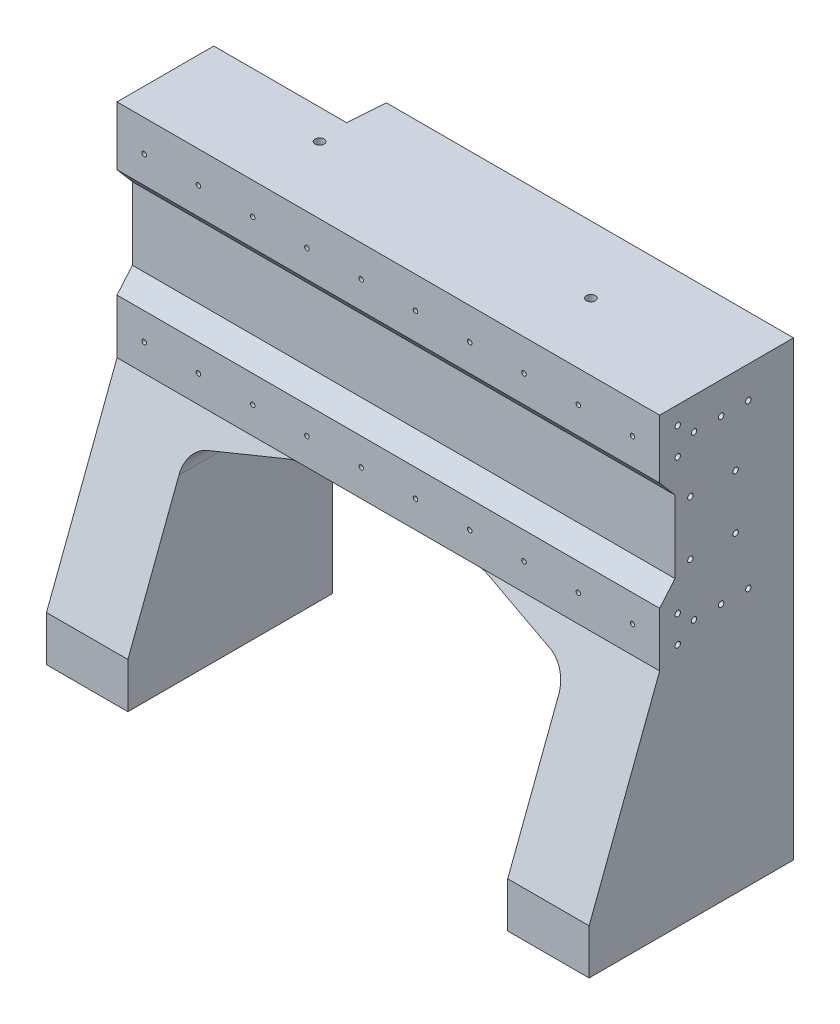
from build123d import *

# Parameters (mm, degrees)
SKETCH1_W                  = 600
SKETCH1_H                  = 500
BOSS_EXTRUDE1_DEPTH        = 226
SKETCH2_OUTSIDE_W          = 764.614
SKETCH2_OUTSIDE_H          = 664.614
CUT_EXTRUDE1_DEPTH         = 452.193971591
CUT_EXTRUDE8_DEPTH         = 452.193971591
CUT_EXTRUDE2_DEPTH         = 689.168583997
CUT_EXTRUDE3_DEPTH         = 689.168583997
SKETCH7_R                  = 2.5
CUT_EXTRUDE5_DEPTH         = 25
SKETCH8_R                  = 9.525
CUT_EXTRUDE6_DEPTH         = 35
F_6_0MM_DOWEL_HOLE1_D      = 6
F_6_0MM_DOWEL_HOLE1_DEPTH  = 28.197418143
F_6_0MM_DOWEL_HOLE1_TIP    = 1.802581857
F_6_0MM_DOWEL_HOLE2_D      = 6
F_6_0MM_DOWEL_HOLE2_DEPTH  = 28.197418143
F_6_0MM_DOWEL_HOLE2_TIP    = 1.802581857
F_6_0MM_DOWEL_HOLE3_D      = 6
F_6_0MM_DOWEL_HOLE3_DEPTH  = 28.197418143
F_6_0MM_DOWEL_HOLE3_TIP    = 1.802581857
FILLET2_R                  = 30
F_10_0MM_DOWEL_HOLE1_D     = 10
F_10_0MM_DOWEL_HOLE1_DEPTH = 28
F_10_0MM_DOWEL_HOLE1_TIP   = 3.004303095
CUT_EXTRUDE9_DEPTH         = 35
CHAMFER1_SIZE              = 6
CHAMFER1_SIZE_2            = 114.486820126
CHAMFER2_SIZE              = 3
CHAMFER2_SIZE_2            = 171.477335318
CHAMFER2_SIZE_3            = 42.90199877
CHAMFER3_SIZE              = 3
CHAMFER3_SIZE_2            = 171.477335318
CHAMFER3_SIZE_3            = 42.90199877
FILLET3_R                  = 8


with BuildPart() as part:
    # Sketch1 → Boss-Extrude1 (new body)
    with BuildSketch(Plane.XY):
        Rectangle(SKETCH1_W, SKETCH1_H)
    extrude(amount=BOSS_EXTRUDE1_DEPTH)

    # Sketch2 outside → Cut-Extrude1 (cut, through all)
    with BuildSketch(Plane.XY.offset(226)):
        Rectangle(SKETCH2_OUTSIDE_W, SKETCH2_OUTSIDE_H)
        Polygon((-210, -250), (-210, -225), (-210, -30), (210, -30), (210, -225), (210, -250), (300, -250), (300, 250), (-300, 250), (-300, -250), align=None, mode=Mode.SUBTRACT)
    extrude(amount=-CUT_EXTRUDE1_DEPTH, mode=Mode.SUBTRACT)

    # Sketch22 → Cut-Extrude8 (cut, through all)
    with BuildSketch(Plane.XY.offset(226)):
        Polygon((-210, -30), (210, -30), (105, 5), (0, 5), (-105, 5), align=None)
    extrude(amount=-CUT_EXTRUDE8_DEPTH, mode=Mode.SUBTRACT)

    # Sketch4 → Cut-Extrude2 (cut, through all)
    with BuildSketch(Plane.ZY.offset(300)):
        Polygon((148, 25), (148, 5), (226, -200), (226, -165), (226, -145), (226, 250), (148, 250), align=None)
    extrude(amount=-CUT_EXTRUDE2_DEPTH, mode=Mode.SUBTRACT)

    # Sketch5 → Cut-Extrude3 (cut, through all)
    with BuildSketch(Plane.ZY.offset(300)):
        Polygon((131, 160), (131, 165), (148, 185), (148, 65), (131, 85), (131, 90), (131, 125), align=None)
    extrude(amount=-CUT_EXTRUDE3_DEPTH, mode=Mode.SUBTRACT)

    # Sketch7 → Cut-Extrude5 (cut)
    with BuildSketch(Plane.XY.offset(148)):
        with Locations((-270, 215)):
            Circle(SKETCH7_R)
        with Locations((-210, 215)):
            Circle(SKETCH7_R)
        with Locations((-150, 215)):
            Circle(SKETCH7_R)
        with Locations((-90, 215)):
            Circle(SKETCH7_R)
        with Locations((-30, 215)):
            Circle(SKETCH7_R)
        with Locations((30, 215)):
            Circle(SKETCH7_R)
        with Locations((90, 215)):
            Circle(SKETCH7_R)
        with Locations((150, 215)):
            Circle(SKETCH7_R)
        with Locations((210, 215)):
            Circle(SKETCH7_R)
        with Locations((270, 215)):
            Circle(SKETCH7_R)
        with Locations((-210, 35)):
            Circle(SKETCH7_R)
        with Locations((-150, 35)):
            Circle(SKETCH7_R)
        with Locations((-90, 35)):
            Circle(SKETCH7_R)
        with Locations((-30, 35)):
            Circle(SKETCH7_R)
        with Locations((30, 35)):
            Circle(SKETCH7_R)
        with Locations((90, 35)):
            Circle(SKETCH7_R)
        with Locations((150, 35)):
            Circle(SKETCH7_R)
        with Locations((210, 35)):
            Circle(SKETCH7_R)
        with Locations((270, 35)):
            Circle(SKETCH7_R)
        with Locations((-270, 35)):
            Circle(SKETCH7_R)
    extrude(amount=-CUT_EXTRUDE5_DEPTH, mode=Mode.SUBTRACT)

    # Sketch8 → Cut-Extrude6 (cut)
    with BuildSketch(Plane.XZ.offset(250)):
        with Locations((240, 171)):
            Circle(SKETCH8_R)
        with Locations((275, 171)):
            Circle(SKETCH8_R)
        with Locations((240, 51)):
            Circle(SKETCH8_R)
        with Locations((275, 51)):
            Circle(SKETCH8_R)
        with Locations((-275, 51)):
            Circle(SKETCH8_R)
        with Locations((-240, 51)):
            Circle(SKETCH8_R)
        with Locations((-275, 171)):
            Circle(SKETCH8_R)
        with Locations((-240, 171)):
            Circle(SKETCH8_R)
    extrude(amount=-CUT_EXTRUDE6_DEPTH, mode=Mode.SUBTRACT)

    # Ø6.0mm Dowel Hole1
    with Locations(Plane.ZY.offset(300)):
        with Locations((114, 95), (64, 95), (64, 155), (114, 155), (98, 230), (98, 200), (98, 50), (98, 20), (68, 230), (68, 200), (68, 50), (68, 20)):
            Hole(F_6_0MM_DOWEL_HOLE1_D / 2, depth=F_6_0MM_DOWEL_HOLE1_DEPTH)
            with Locations((0, 0, -(F_6_0MM_DOWEL_HOLE1_DEPTH + F_6_0MM_DOWEL_HOLE1_TIP / 2))):  # 118° drill point
                Cone(0, F_6_0MM_DOWEL_HOLE1_D / 2, F_6_0MM_DOWEL_HOLE1_TIP, mode=Mode.SUBTRACT)

    # Ø6.0mm Dowel Hole2
    with Locations(Plane(origin=(300, 0, 0), x_dir=(0, 0, -1), z_dir=(1, 0, 0))):
        with Locations((-128, 230), (-128, 200), (-114, 155), (-64, 155), (-64, 95), (-114, 95), (-128, 50), (-128, 20)):
            Hole(F_6_0MM_DOWEL_HOLE2_D / 2, depth=F_6_0MM_DOWEL_HOLE2_DEPTH)
            with Locations((0, 0, -(F_6_0MM_DOWEL_HOLE2_DEPTH + F_6_0MM_DOWEL_HOLE2_TIP / 2))):  # 118° drill point
                Cone(0, F_6_0MM_DOWEL_HOLE2_D / 2, F_6_0MM_DOWEL_HOLE2_TIP, mode=Mode.SUBTRACT)

    # Ø6.0mm Dowel Hole3
    with Locations(Plane(origin=(300, 0, 0), x_dir=(0, 0, -1), z_dir=(1, 0, 0))):
        with Locations((-110, 215), (-80, 215), (-50, 215), (-50, 35), (-80, 35), (-110, 35)):
            Hole(F_6_0MM_DOWEL_HOLE3_D / 2, depth=F_6_0MM_DOWEL_HOLE3_DEPTH)
            with Locations((0, 0, -(F_6_0MM_DOWEL_HOLE3_DEPTH + F_6_0MM_DOWEL_HOLE3_TIP / 2))):  # 118° drill point
                Cone(0, F_6_0MM_DOWEL_HOLE3_D / 2, F_6_0MM_DOWEL_HOLE3_TIP, mode=Mode.SUBTRACT)

    # Fillet2
    fillet2_edges = [part.edges().sort_by_distance(p)[0] for p in [
        (210, -30, 80.658536585),
        (-210, -30, 80.658536585),
        (-105, 5, 74),
        (105, 5, 74),
    ]]
    fillet(fillet2_edges, radius=FILLET2_R)

    # Ø10.0mm Dowel Hole1
    with Locations(Plane(origin=(0, 250, 0), x_dir=(1, 0, 0), z_dir=(0, 1, 0))):
        with Locations((-150, -74), (150, -74)):
            Hole(F_10_0MM_DOWEL_HOLE1_D / 2, depth=F_10_0MM_DOWEL_HOLE1_DEPTH)
            with Locations((0, 0, -(F_10_0MM_DOWEL_HOLE1_DEPTH + F_10_0MM_DOWEL_HOLE1_TIP / 2))):  # 118° drill point
                Cone(0, F_10_0MM_DOWEL_HOLE1_D / 2, F_10_0MM_DOWEL_HOLE1_TIP, mode=Mode.SUBTRACT)

    # Sketch10 → Cut-Extrude9 (cut)
    with BuildSketch(Plane(origin=(0, 0, 0), x_dir=(-1, 0, 0), z_dir=(0, 0, -1))):
        Polygon((150, 142), (150, 138), (235, 138), (235, 142), (235, 155), (300, 155), (300, 250), (150, 250), (150, 155), align=None)
    extrude(amount=-CUT_EXTRUDE9_DEPTH, mode=Mode.SUBTRACT)

    # Chamfer1
    # the kernel refuses this chamfer: 114.486820126, 6 mm, written as the material it takes off along each edge
    with BuildSketch(Plane(origin=(-597.650645388, 250, 35), x_dir=(0, 0.5911482838883376, 0.8065628967761121), z_dir=(1, 0, 0))) as chamfer1_piece_1_section:
        Polygon((CHAMFER1_SIZE * 0.806562896776, CHAMFER1_SIZE * 0.591148283888), (-CHAMFER1_SIZE_2 * 0.59114828389, CHAMFER1_SIZE_2 * 0.806562896779), (0, 0), align=None)
    chamfer1_piece_1 = extrude(amount=447.650645388, mode=Mode.PRIVATE)
    chamfer1_piece_1 = split(chamfer1_piece_1, bisect_by=Plane(origin=(-267.5, 155, 37.049515036), z_dir=(0, 1, 0)), keep=Keep.TOP, mode=Mode.PRIVATE)
    add(chamfer1_piece_1, mode=Mode.SUBTRACT)
    with BuildSketch(Plane(origin=(-597.650645388, 250, 35), x_dir=(0, 0.5911482838883376, 0.8065628967761121), z_dir=(1, 0, 0))) as chamfer1_piece_2_section:
        Polygon((CHAMFER1_SIZE * 0.806562896776, CHAMFER1_SIZE * 0.591148283888), (-CHAMFER1_SIZE_2 * 0.59114828389, CHAMFER1_SIZE_2 * 0.806562896779), (0, 0), align=None)
    chamfer1_piece_2 = extrude(amount=447.650645388, mode=Mode.PRIVATE)
    chamfer1_piece_2 = split(chamfer1_piece_2, bisect_by=Plane(origin=(-192.5, 138, 35.345336882), z_dir=(0, 1, 0)), keep=Keep.TOP, mode=Mode.PRIVATE)
    chamfer1_piece_2 = split(chamfer1_piece_2, bisect_by=Plane(origin=(-235, 148.692020353, 35.345336882), z_dir=(1, 0, 0)), keep=Keep.TOP, mode=Mode.PRIVATE)
    add(chamfer1_piece_2, mode=Mode.SUBTRACT)

    # Chamfer2
    # the kernel refuses this chamfer: 171.477335318, 42.90199877, 3 mm, written as the material it adds along each edge
    with BuildSketch(Plane(origin=(-300, 155, 36.021260968), x_dir=(0, 0.4058983906880882, 0.9139182110215444), z_dir=(1, 0, 0))) as chamfer2_piece_1_section:
        Polygon((CHAMFER2_SIZE * 0.453172904552, -CHAMFER2_SIZE * 0.891422637462), (-CHAMFER2_SIZE_2 * 0.913918211021, -CHAMFER2_SIZE_2 * 0.405898390688), (0, 0), align=None)
    chamfer2_piece_1 = extrude(amount=65, mode=Mode.PRIVATE)
    chamfer2_piece_1 = split(chamfer2_piece_1, bisect_by=Plane(origin=(-267.5, 156.347115751, 0), z_dir=(0, 0, 1)), keep=Keep.TOP, mode=Mode.PRIVATE)
    add(chamfer2_piece_1)
    # the kernel refuses this chamfer: 171.477335318, 42.90199877, 3 mm, written as the material it adds along each edge
    with BuildSketch(Plane(origin=(-235, 269.37818115, 42.015567441), x_dir=(0.8766829747338777, -0.025177183236006113, 0.4804092747398407), z_dir=(-1.4194297151346516e-15, -0.9986295347545833, -0.0523359562427643))) as chamfer2_2_piece_1_section:
        Polygon((CHAMFER2_SIZE * 0.876682974734, -CHAMFER2_SIZE * 0.481068562485), (-CHAMFER2_SIZE_3 * 0.481068562487, -CHAMFER2_SIZE_3 * 0.876682974737), (0, 0), align=None)
    chamfer2_2_piece_1 = extrude(amount=243.09362506, mode=Mode.PRIVATE)
    chamfer2_2_piece_1 = split(chamfer2_2_piece_1, bisect_by=Plane(origin=(-233.972430934, 147.892877169, 0), z_dir=(0, 0, 1)), keep=Keep.TOP, mode=Mode.PRIVATE)
    chamfer2_2_piece_1 = split(chamfer2_2_piece_1, bisect_by=Plane(origin=(-233.972430934, 157.747464866, 21.946082382), z_dir=(0, -0.9998476951563882, 0.017452406437459534)), keep=Keep.TOP, mode=Mode.PRIVATE)
    add(chamfer2_2_piece_1)

    # Chamfer3
    # the kernel refuses this chamfer: 171.477335318, 42.90199877, 3 mm, written as the material it adds along each edge
    with BuildSketch(Plane(origin=(-677.838560586, 138, 35.13032872), x_dir=(0, 0.4058983906880882, 0.9139182110215444), z_dir=(1, 0, 0))) as chamfer3_piece_1_section:
        Polygon((CHAMFER3_SIZE * 0.453172904552, -CHAMFER3_SIZE * 0.891422637462), (-CHAMFER3_SIZE_2 * 0.913918211021, -CHAMFER3_SIZE_2 * 0.405898390688), (0, 0), align=None)
    chamfer3_piece_1 = extrude(amount=973.677121172, mode=Mode.PRIVATE)
    chamfer3_piece_1 = split(chamfer3_piece_1, bisect_by=Plane(origin=(-300, 139.34996863, 18.189156811), z_dir=(1, 0, 0)), keep=Keep.TOP, mode=Mode.PRIVATE)
    chamfer3_piece_1 = split(chamfer3_piece_1, bisect_by=Plane(origin=(-191.593979547, 139.34996863, 0), z_dir=(0, 0, 1)), keep=Keep.TOP, mode=Mode.PRIVATE)
    add(chamfer3_piece_1)
    # the kernel refuses this chamfer: 171.477335318, 42.90199877, 3 mm, written as the material it adds along each edge
    with BuildSketch(Plane(origin=(-150, 29.613596059, 29.450037985), x_dir=(-0.8766829747338778, -0.025177183236005013, 0.4804092747398405), z_dir=(0, 0.9986295347545833, 0.052335956242764624))) as chamfer3_2_piece_1_section:
        Polygon((CHAMFER3_SIZE * 0.876682974734, -CHAMFER3_SIZE * 0.481068562485), (-CHAMFER3_SIZE_3 * 0.481068562487, -CHAMFER3_SIZE_3 * 0.876682974737), (0, 0), align=None)
    chamfer3_2_piece_1 = extrude(amount=332.223997929, mode=Mode.PRIVATE)
    chamfer3_2_piece_1 = split(chamfer3_2_piece_1, bisect_by=Plane(origin=(-151.011869229, 250, 24.17159315), z_dir=(0, -1, 0)), keep=Keep.TOP, mode=Mode.PRIVATE)
    chamfer3_2_piece_1 = split(chamfer3_2_piece_1, bisect_by=Plane(origin=(-151.011869229, 195.655839269, 0), z_dir=(0, 0, 1)), keep=Keep.TOP, mode=Mode.PRIVATE)
    add(chamfer3_2_piece_1)

    # Fillet3
    fillet3_edges = [part.edges().sort_by_distance(p)[0] for p in [
        (-233.262026443, 157.680141588, 18.089134418),
        (-233.230947563, 140.687917229, 17.643668295),
        (-151.769052437, 140.687917229, 17.643668295),
    ]]
    fillet(fillet3_edges, radius=FILLET3_R)


solid = part.part
